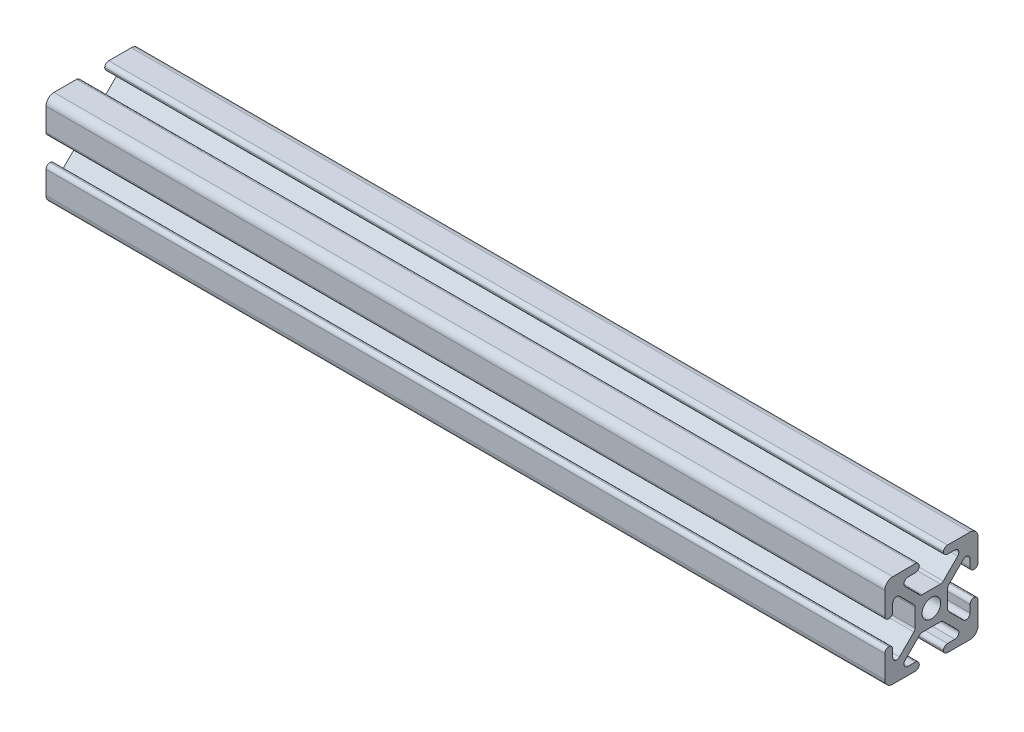
from build123d import *

# Parameters (mm, degrees)
SKETCH1_R           = 2.5
BOSS_EXTRUDE1_DEPTH = 225
FILLET1_R           = 1.065
FILLET2_R           = 2.13


with BuildPart() as part:
    # Sketch1 → Boss-Extrude1 (new body)
    with BuildSketch(Plane.YZ):
        Polygon((-12.5, -3.25), (-12.5, -12.5), (-3.25, -12.5), (-3.25, -10.37), (-8.863862556, -10.37), (-2.873862556, -4.38), (2.873862556, -4.38), (8.863862556, -10.37), (3.25, -10.37), (3.25, -12.5), (12.5, -12.5), (12.5, -3.25), (10.37, -3.25), (10.37, -8.863862556), (4.38, -2.873862556), (4.38, 2.873862556), (10.37, 8.863862556), (10.37, 3.25), (12.5, 3.25), (12.5, 12.5), (3.25, 12.5), (3.25, 10.37), (8.863862556, 10.37), (2.873862556, 4.38), (-2.873862556, 4.38), (-8.863862556, 10.37), (-3.25, 10.37), (-3.25, 12.5), (-12.5, 12.5), (-12.5, 3.25), (-10.37, 3.25), (-10.37, 8.863862556), (-4.38, 2.873862556), (-4.38, -2.873862556), (-10.37, -8.863862556), (-10.37, -3.25), align=None)
        with Locations(Location((0, 0, 0), (0, 0, 270))):
            Circle(SKETCH1_R, mode=Mode.SUBTRACT)
    extrude(amount=BOSS_EXTRUDE1_DEPTH)

    # Fillet1
    fillet1_edges = [part.edges().sort_by_distance(p)[0] for p in [
        (112.5, -10.37, -8.863862556),
        (112.5, 2.873862556, -4.38),
        (112.5, -2.873862556, -4.38),
        (112.5, -4.38, 2.873862556),
        (112.5, -4.38, -2.873862556),
        (112.5, -2.873862556, 4.38),
        (112.5, 2.873862556, 4.38),
        (112.5, 4.38, 2.873862556),
        (112.5, 4.38, -2.873862556),
        (112.5, -8.863862556, -10.37),
        (112.5, 8.863862556, -10.37),
        (112.5, 10.37, -8.863862556),
        (112.5, -10.37, 8.863862556),
        (112.5, -8.863862556, 10.37),
        (112.5, 10.37, 8.863862556),
        (112.5, 8.863862556, 10.37),
        (112.5, 12.5, 3.25),
        (112.5, -3.25, -12.5),
        (112.5, -10.37, 3.25),
        (112.5, 10.37, 3.25),
        (112.5, -10.37, -3.25),
        (112.5, -12.5, -3.25),
        (112.5, -12.5, 3.25),
        (112.5, 3.25, -10.37),
        (112.5, -3.25, -10.37),
        (112.5, 3.25, -12.5),
        (112.5, 10.37, -3.25),
        (112.5, 12.5, -3.25),
        (112.5, 3.25, 12.5),
        (112.5, 3.25, 10.37),
        (112.5, -3.25, 10.37),
        (112.5, -3.25, 12.5),
    ]]
    fillet(fillet1_edges, radius=FILLET1_R - 0.0001)  # a hair under: the kernel refuses the full size

    # Fillet2
    fillet2_edges = [part.edges().sort_by_distance(p)[0] for p in [
        (112.5, -12.5, 12.5),
        (112.5, 12.5, 12.5),
        (112.5, 12.5, -12.5),
        (112.5, -12.5, -12.5),
    ]]
    fillet(fillet2_edges, radius=FILLET2_R)


solid = part.part
